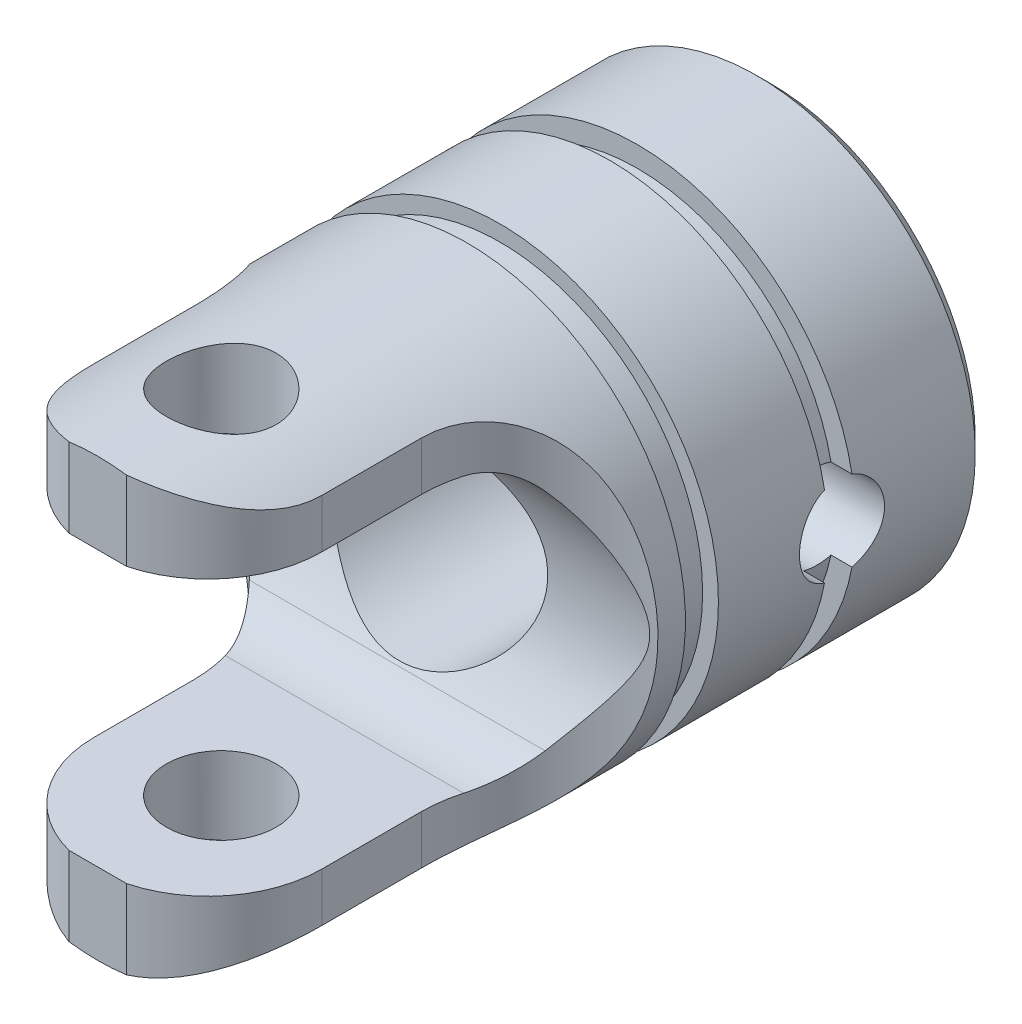
from build123d import *

# Parameters (mm, degrees)
SKETCH1_R               = 15.9
BOSS_EXTRUDE1_DEPTH     = 49
SKETCH2_R               = 8
CUT_EXTRUDE1_DEPTH      = 49
CUT_EXTRUDE2_DEPTH      = 54.913078191
CUT_EXTRUDE2_DEPTH_BACK = 54.913078191
SKETCH3_R               = 3.1
SKETCH6_W               = 3
SKETCH6_H               = 2
SKETCH7_W               = 2.3
SKETCH7_H               = 2.4
CUT_EXTRUDE3_DEPTH      = 54.913078341
CUT_EXTRUDE3_DEPTH_BACK = 54.913078341
CUT_EXTRUDE4_DEPTH      = 54.913078341
CUT_EXTRUDE4_DEPTH_BACK = 54.913078341
CHAMFER1_SIZE           = 1
CUT_EXTRUDE5_DEPTH      = 58.659518019
CUT_EXTRUDE5_DEPTH_BACK = 58.659518019
SKETCH10_R              = 4
FILLET2_R               = 5


with BuildPart() as part:
    # Sketch1 → Boss-Extrude1 (new body)
    with BuildSketch(Plane.XY):
        Circle(SKETCH1_R)
    extrude(amount=BOSS_EXTRUDE1_DEPTH)

    # Sketch2 → Cut-Extrude1 (cut)
    with BuildSketch(Plane.XY):
        Circle(SKETCH2_R)
    extrude(amount=CUT_EXTRUDE1_DEPTH, mode=Mode.SUBTRACT)

    # Sketch3 → Cut-Extrude2 (cut, two sides: drawn at the far end of the back side and taken through both)
    with BuildSketch(Plane(origin=(0, 0, 0), x_dir=(0, 0, -1), z_dir=(1, 0, 0)).offset(-CUT_EXTRUDE2_DEPTH_BACK)):
        with Locations((-10.7, 0)):
            Circle(SKETCH3_R)
    extrude(amount=CUT_EXTRUDE2_DEPTH + CUT_EXTRUDE2_DEPTH_BACK, mode=Mode.SUBTRACT)

    # Sketch6 → Cut-Revolve2 (revolve, cut)
    with BuildSketch(Plane(origin=(0, 0, 0), x_dir=(1, 0, 0), z_dir=(0, 1, 0))):
        with Locations((15.9, -10.7)):
            Rectangle(SKETCH6_W, SKETCH6_H)
    revolve(axis=Axis((0, 0, 49), (0, 0, -1)), mode=Mode.SUBTRACT)

    # Sketch7 → Cut-Revolve3 (revolve, cut)
    with BuildSketch(Plane(origin=(0, 0, 0), x_dir=(1, 0, 0), z_dir=(0, 1, 0))):
        with Locations((15.9, -20.9)):
            Rectangle(SKETCH7_W, SKETCH7_H)
    revolve(axis=Axis((0, 0, 0), (0, 0, 1)), mode=Mode.SUBTRACT)

    # Sketch8 → Cut-Extrude3 (cut, two sides: drawn at the far end of the back side and taken through both)
    with BuildSketch(Plane(origin=(0, 0, 0), x_dir=(1, 0, 0), z_dir=(0, 1, 0)).offset(-CUT_EXTRUDE3_DEPTH_BACK)):
        with BuildLine():
            Line((15.9, -24.1), (15.9, -43.362187412))
            Line((15.9, -43.362187412), (15.9, -50.372696334))
            Line((15.9, -50.372696334), (-15.9, -50.372696334))
            Line((-15.9, -50.372696334), (-15.9, -24.1))
            ThreePointArc((-15.9, -24.1), (-10.428826144, -27.596805525), (-8.3, -33.731093706))
            Line((-8.3, -33.731093706), (-8.3, -40.97005604))
            ThreePointArc((-8.3, -40.97005604), (0, -49.27005604), (8.3, -40.97005604))
            Line((8.3, -40.97005604), (8.3, -33.731093706))
            ThreePointArc((8.3, -33.731093706), (10.428826144, -27.596805525), (15.9, -24.1))
        make_face()
    extrude(amount=CUT_EXTRUDE3_DEPTH + CUT_EXTRUDE3_DEPTH_BACK, mode=Mode.SUBTRACT)

    # Sketch9 → Cut-Extrude4 (cut, two sides: drawn at the far end of the back side and taken through both)
    with BuildSketch(Plane(origin=(0, 0, 0), x_dir=(0, 0, -1), z_dir=(1, 0, 0)).offset(-CUT_EXTRUDE4_DEPTH_BACK)):
        with BuildLine():
            Line((-29.056803626, 10), (-49.056803626, 10))
            Line((-49.056803626, 10), (-49.025089954, -10))
            Line((-49.025089954, -10), (-29.025089954, -10))
            ThreePointArc((-29.025089954, -10), (-24.22526277, 0.007636151), (-29.056803626, 10))
        make_face()
    extrude(amount=CUT_EXTRUDE4_DEPTH + CUT_EXTRUDE4_DEPTH_BACK, mode=Mode.SUBTRACT)

    # Chamfer1
    chamfer1_edges = [part.edges().sort_by_distance(p)[0] for p in [
        (-8, 0, 0),
        (-15.9, 0, 0),
    ]]
    chamfer(chamfer1_edges, length=CHAMFER1_SIZE)

    # Sketch10 → Cut-Extrude5 (cut, two sides: drawn at the far end of the back side and taken through both)
    with BuildSketch(Plane(origin=(0, -10, 0), x_dir=(1, 0, 0), z_dir=(0, 1, 0)).offset(-CUT_EXTRUDE5_DEPTH_BACK)):
        with Locations((0, -40)):
            Circle(SKETCH10_R)
    extrude(amount=CUT_EXTRUDE5_DEPTH + CUT_EXTRUDE5_DEPTH_BACK, mode=Mode.SUBTRACT)

    # Fillet2
    fillet2_edges = [part.edges().sort_by_distance(p)[0] for p in [
        (0, -10, 29.025089954),
        (0, 10, 29.056803626),
    ]]
    fillet(fillet2_edges, radius=FILLET2_R)


solid = part.part
